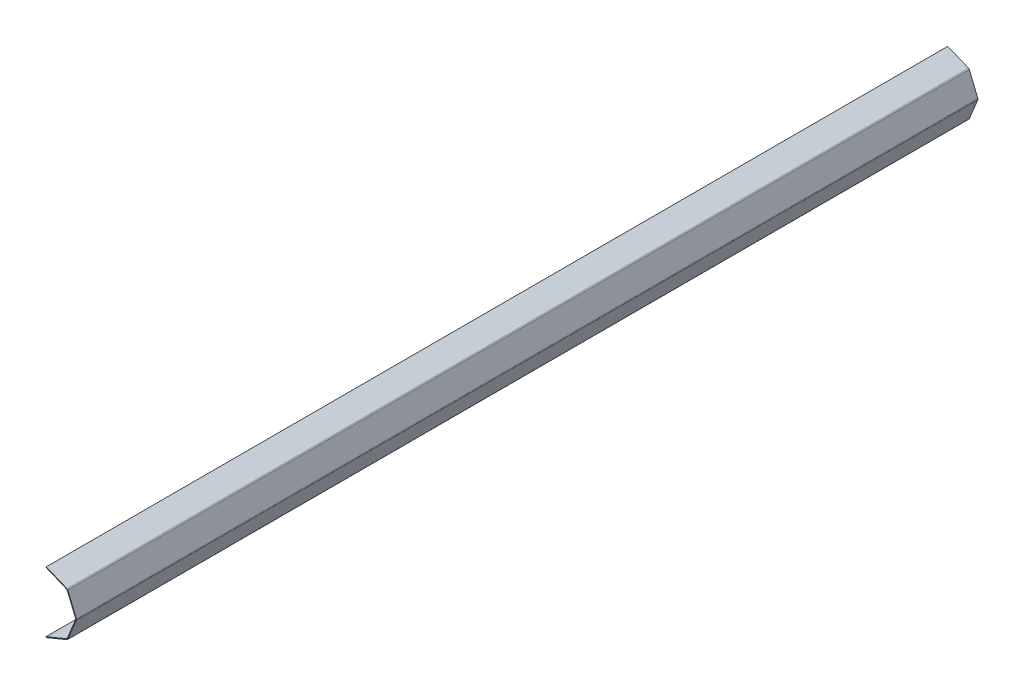
from build123d import *

# Parameters (mm, degrees)
TABAN_FLAN_1_DEPTH = 5990


# Sheet-metal steps are written as plain solids
with BuildPart() as part:
    # Çizim1 → Taban-Flanş1 (new body)
    with BuildSketch(Plane.XY):
        with BuildLine():
            Line((1.913417162, -199.207436661), (139.507939075, -142.213919576))
            ThreePointArc((139.507939075, -142.213919576), (141.13005582, -141.13005582), (142.213919576, -139.507939075))
            Line((142.213919576, -139.507939075), (199.207436661, -1.913417162))
            ThreePointArc((199.207436661, -1.913417162), (199.588038999, 0), (199.207436661, 1.913417162))
            Line((199.207436661, 1.913417162), (142.213919576, 139.507939075))
            ThreePointArc((142.213919576, 139.507939075), (141.13005582, 141.13005582), (139.507939075, 142.213919576))
            Line((139.507939075, 142.213919576), (1.913417162, 199.207436661))
            Line((1.913417162, 199.207436661), (3.826834324, 203.826834324))
            Line((3.826834324, 203.826834324), (141.421356237, 146.833317239))
            ThreePointArc((141.421356237, 146.833317239), (144.665589726, 144.665589726), (146.833317239, 141.421356237))
            Line((146.833317239, 141.421356237), (203.826834324, 3.826834324))
            ThreePointArc((203.826834324, 3.826834324), (204.588038999, 0), (203.826834324, -3.826834324))
            Line((203.826834324, -3.826834324), (146.833317239, -141.421356237))
            ThreePointArc((146.833317239, -141.421356237), (144.665589726, -144.665589726), (141.421356237, -146.833317239))
            Line((141.421356237, -146.833317239), (3.826834324, -203.826834324))
            Line((3.826834324, -203.826834324), (1.913417162, -199.207436661))
        make_face()
    extrude(amount=TABAN_FLAN_1_DEPTH)


solid = part.part
